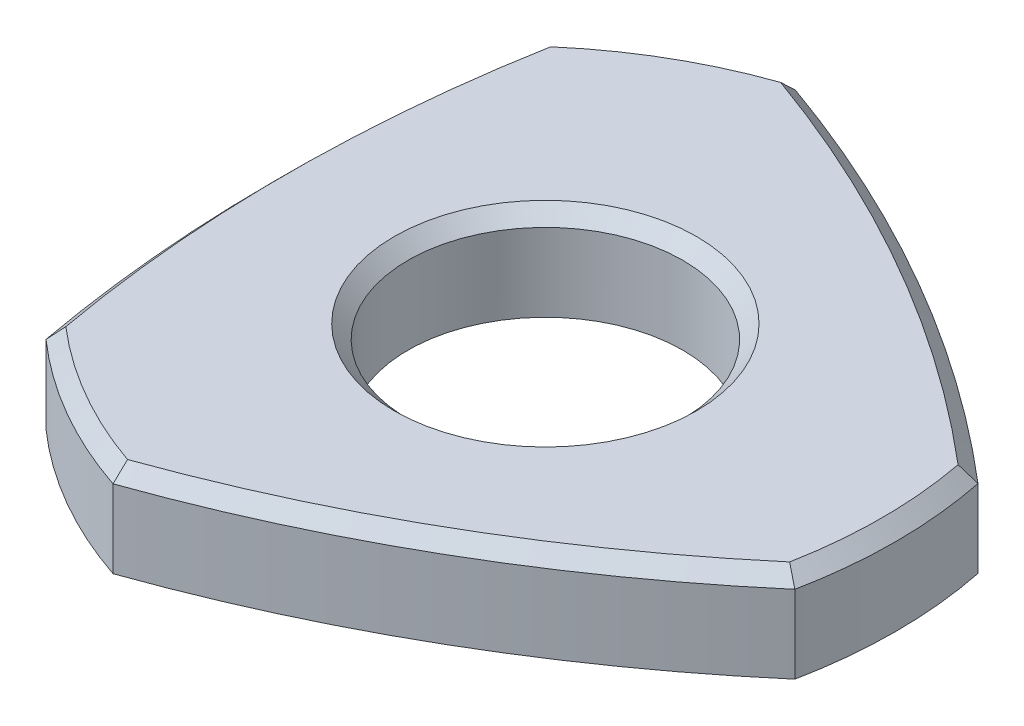
from build123d import *

# Parameters (mm, degrees)
SKETCH1_R           = 30
BOSS_EXTRUDE1_DEPTH = 20
CHAMFER1_SIZE       = 3


with BuildPart() as part:
    # Sketch1 → Boss-Extrude1 (new body)
    with BuildSketch(Plane(origin=(0, 0, 0), x_dir=(1, 0, 0), z_dir=(0, 1, 0))):
        with BuildLine():
            ThreePointArc((-54.559600438, 54.5), (-59.559600438, 0), (-54.559600438, -54.5))
            ThreePointArc((-54.559600438, -54.5), (-38.239092363, -66.232050808), (-19.918584287, -74.5))
            ThreePointArc((-19.918584287, -74.5), (29.779800219, -51.580127019), (74.478184725, -20))
            ThreePointArc((74.478184725, -20), (76.478184725, 0), (74.478184725, 20))
            ThreePointArc((74.478184725, 20), (29.779800219, 51.580127019), (-19.918584287, 74.5))
            ThreePointArc((-19.918584287, 74.5), (-38.239092363, 66.232050808), (-54.559600438, 54.5))
        make_face()
        Circle(SKETCH1_R, mode=Mode.SUBTRACT)
    extrude(amount=BOSS_EXTRUDE1_DEPTH)

    # Chamfer1
    chamfer1_edges = [part.edges().sort_by_distance(p)[0] for p in [
        (-30, 20, 0),
        (29.779800219, 20, -51.580127019),
        (76.478184725, 20, 0),
        (29.779800219, 20, 51.580127019),
        (-38.239092363, 20, 66.232050808),
        (-59.559600438, 20, 0),
        (-38.239092363, 20, -66.232050808),
    ]]
    chamfer(chamfer1_edges, length=CHAMFER1_SIZE)


solid = part.part
